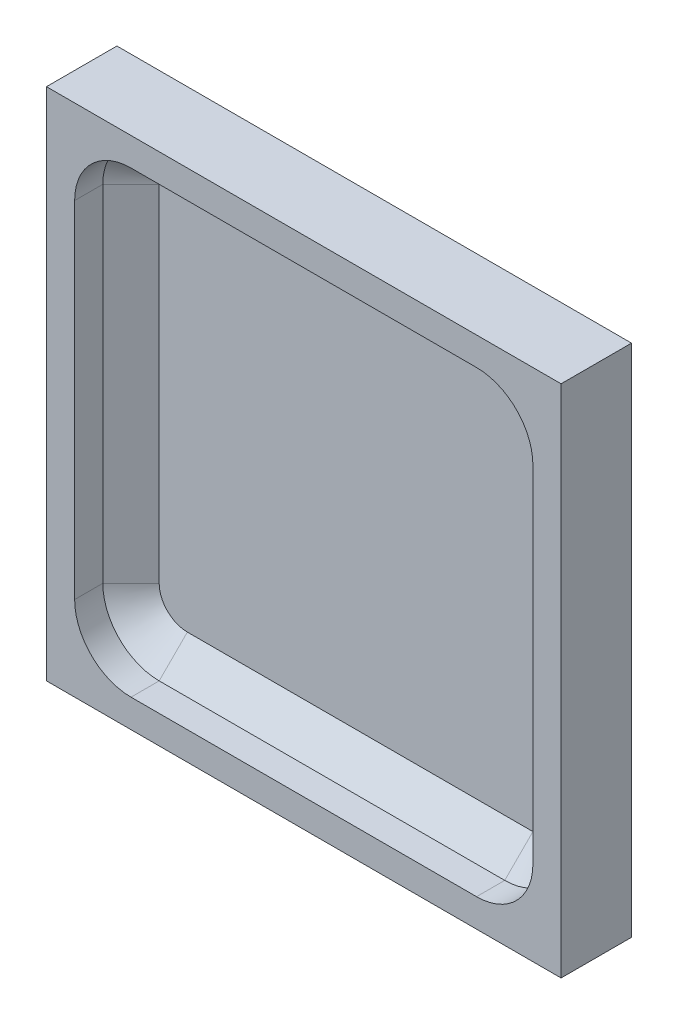
from build123d import *

# Parameters (mm, degrees)
SKETCH1_W           = 36.526911934
SKETCH1_H           = 36.526911934
BOSS_EXTRUDE1_DEPTH = 5
CAVITY1_START       = -2
CAVITY1_DEPTH       = 2


with BuildPart() as part:
    # Sketch1 → Boss-Extrude1 (new body)
    with BuildSketch(Plane.XY):
        Rectangle(SKETCH1_W, SKETCH1_H)
    extrude(amount=-BOSS_EXTRUDE1_DEPTH)

    # Cavity1: read off the stored shape, not the designer's step
    # Cavity1 outline → Cavity1 (cut)
    with BuildSketch(Plane.XY.offset(CAVITY1_START)):
        with BuildLine():
            Line((16.263455967, -12.263455967), (16.263455967, 12.263455967))
            ThreePointArc((16.263455967, 12.263455967), (15.091883092, 15.091883092), (12.263455967, 16.263455967))
            Line((12.263455967, 16.263455967), (-12.263455967, 16.263455967))
            ThreePointArc((-12.263455967, 16.263455967), (-15.091883092, 15.091883092), (-16.263455967, 12.263455967))
            Line((-16.263455967, 12.263455967), (-16.263455967, -12.263455967))
            ThreePointArc((-16.263455967, -12.263455967), (-15.091883092, -15.091883092), (-12.263455967, -16.263455967))
            Line((-12.263455967, -16.263455967), (12.263455967, -16.263455967))
            ThreePointArc((12.263455967, -16.263455967), (15.091883092, -15.091883092), (16.263455967, -12.263455967))
        make_face()
    extrude(amount=CAVITY1_DEPTH, mode=Mode.SUBTRACT)

    # Cavity1 2: loft between two sections, ruled curve by curve
    cavity1_2_from = [
        Edge.make_three_point_arc((14.263455967, 12.263455967, -4), (13.67766953, 13.67766953, -4), (12.263455967, 14.263455967, -4)),
        Edge.make_three_point_arc((-12.263455967, 14.263455967, -4), (-13.67766953, 13.67766953, -4), (-14.263455967, 12.263455967, -4)),
        Edge.make_three_point_arc((12.263455967, -14.263455967, -4), (13.67766953, -13.67766953, -4), (14.263455967, -12.263455967, -4)),
        Edge.make_three_point_arc((-14.263455967, -12.263455967, -4), (-13.67766953, -13.67766953, -4), (-12.263455967, -14.263455967, -4)),
        Edge.make_line((-12.263455967, 14.263455967, -4), (12.263455967, 14.263455967, -4)),
        Edge.make_line((14.263455967, 12.263455967, -4), (14.263455967, -12.263455967, -4)),
        Edge.make_line((-14.263455967, 12.263455967, -4), (-14.263455967, -12.263455967, -4)),
        Edge.make_line((12.263455967, -14.263455967, -4), (-12.263455967, -14.263455967, -4)),
    ]
    cavity1_2_to = [
        Edge.make_three_point_arc((16.263455967, 12.263455967, -2), (15.091883092, 15.091883092, -2), (12.263455967, 16.263455967, -2)),
        Edge.make_three_point_arc((-12.263455967, 16.263455967, -2), (-15.091883092, 15.091883092, -2), (-16.263455967, 12.263455967, -2)),
        Edge.make_three_point_arc((12.263455967, -16.263455967, -2), (15.091883092, -15.091883092, -2), (16.263455967, -12.263455967, -2)),
        Edge.make_three_point_arc((-16.263455967, -12.263455967, -2), (-15.091883092, -15.091883092, -2), (-12.263455967, -16.263455967, -2)),
        Edge.make_line((-12.263455967, 16.263455967, -2), (12.263455967, 16.263455967, -2)),
        Edge.make_line((16.263455967, 12.263455967, -2), (16.263455967, -12.263455967, -2)),
        Edge.make_line((-16.263455967, 12.263455967, -2), (-16.263455967, -12.263455967, -2)),
        Edge.make_line((12.263455967, -16.263455967, -2), (-12.263455967, -16.263455967, -2)),
    ]
    cavity1_2 = Solid(Shell([*[Face.make_surface_from_curves(cavity1_2_from[k], cavity1_2_to[k]) for k in range(8)], Face(Wire(cavity1_2_from)), Face(Wire(cavity1_2_to))]))
    add(cavity1_2, mode=Mode.SUBTRACT)


solid = part.part
